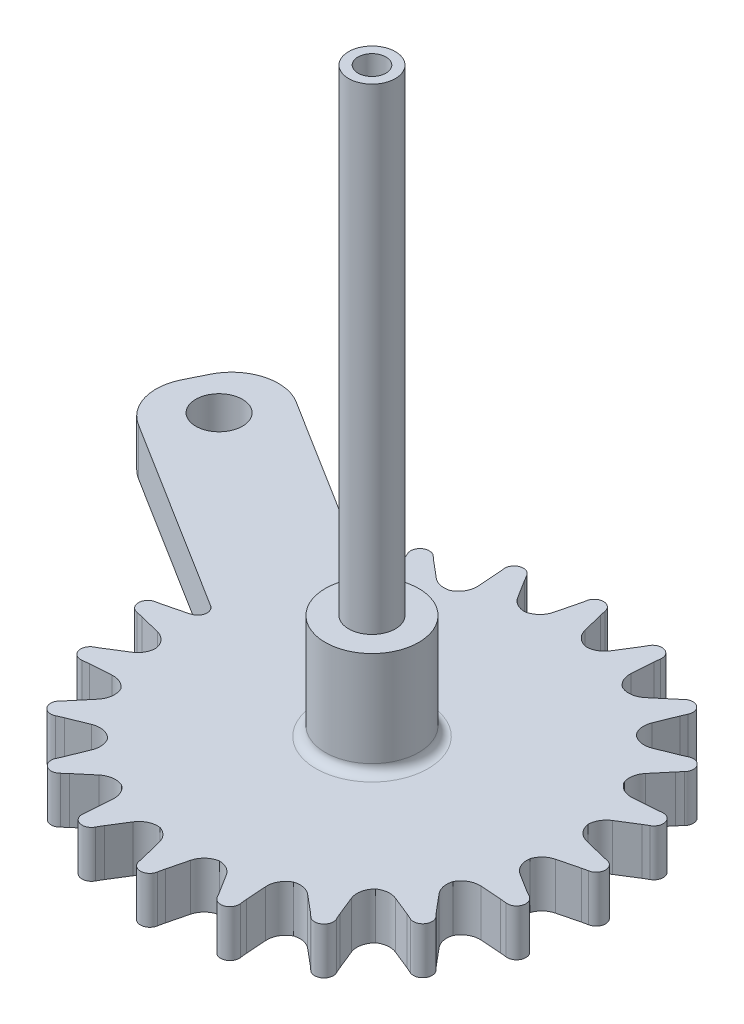
from build123d import *

# Parameters (mm, degrees)
SKETCH1_R           = 20
BOSS_EXTRUDE1_DEPTH = 5
BOSS_EXTRUDE2_START = -5
BOSS_EXTRUDE2_DEPTH = 5
FILLET1_R           = 2
CIRPATTERN1_DEPTH   = 5
SKETCH4_R           = 2.5
BOSS_EXTRUDE3_DEPTH = 5
FILLET2_R           = 5
SKETCH3_R           = 2.5
BOSS_EXTRUDE4_DEPTH = 62.2
SKETCH5_R           = 1.5
CUT_EXTRUDE1_DEPTH  = 5
FILLET4_R           = 1
SKETCH6_R           = 5
BOSS_EXTRUDE5_DEPTH = 11.2
FILLET5_R           = 1
SKETCH7_R           = 2.5
CUT_EXTRUDE2_DEPTH  = 1


# Read off the part's stored shape, not the designer's step: CirPattern1
with BuildPart() as part:
    # Sketch1 → Boss-Extrude1 (new body)
    with BuildSketch(Plane(origin=(0, 0, 0), x_dir=(1, 0, 0), z_dir=(0, 1, 0))):
        with Locations(Location((0, 0, 0), (0, 0, 270))):
            Circle(SKETCH1_R)
    extrude(amount=BOSS_EXTRUDE1_DEPTH)

    # Sketch2 → Boss-Extrude2 (add)
    with BuildSketch(Plane(origin=(0, 5, 0), x_dir=(1, 0, 0), z_dir=(0, 1, 0)).offset(BOSS_EXTRUDE2_START)):
        with BuildLine():
            Line((-2.105791814, 19.888832063), (-1.238592318, 23.357630049))
            ThreePointArc((-1.238592318, 23.357630049), (-1.158488111, 23.704119695), (-1.090754777, 24.053238521))
            ThreePointArc((-1.090754777, 24.053238521), (-0.109023339, 24.880258639), (0.877972386, 24.059528275))
            ThreePointArc((0.877972386, 24.059528275), (0.941143779, 23.742067411), (1.014556469, 23.426817347))
            Line((1.014556469, 23.426817347), (1.893724984, 19.910143286))
            ThreePointArc((1.893724984, 19.910143286), (-0.106567477, 19.999716082), (-2.105791814, 19.888832063))
        make_face()
    extrude(amount=BOSS_EXTRUDE2_DEPTH)

    # Fillet1
    fillet1_edges = [part.edges().sort_by_distance(p)[0] for p in [
        (1.893724984, 2.5, -19.910143286),
        (-2.105791814, 2.5, -19.888832063),
    ]]
    fillet(fillet1_edges, radius=FILLET1_R)

    # CirPattern1 outline → CirPattern1 (add)
    with BuildSketch(Plane(origin=(0, 0, 0), x_dir=(1, 0, 0), z_dir=(0, 1, 0))):
        with BuildLine():
            ThreePointArc((-18.818349161, -15.020578024), (-18.496093443, -14.870168545), (-18.16869336, -14.731312705))
            Line((-18.16869336, -14.731312705), (-16.10451314, -13.898848252))
            ThreePointArc((-16.10451314, -13.898848252), (-14.969635701, -13.791456908), (-13.960430105, -14.321535926))
            ThreePointArc((-13.960430105, -14.321535926), (-16.121714854, -11.835975249), (-17.845731798, -9.029388491))
            ThreePointArc((-17.845731798, -9.029388491), (-17.643410931, -10.160914391), (-18.097403186, -11.216933153))
            Line((-18.097403186, -11.216933153), (-19.549034688, -12.94914432))
            ThreePointArc((-19.549034688, -12.94914432), (-19.760926451, -13.193835771), (-19.980626471, -13.431541317))
            ThreePointArc((-19.980626471, -13.431541317), (-20.064469753, -14.712450836), (-18.818349161, -15.020578024))
        make_face()
        with BuildLine():
            ThreePointArc((-8.242021953, 19.611282475), (-8.490583131, 18.498764143), (-9.306579914, 17.702756009))
            ThreePointArc((-9.306579914, 17.702756009), (-6.422679306, 18.940675556), (-3.380631018, 19.712212811))
            ThreePointArc((-3.380631018, 19.712212811), (-4.340011374, 19.966775936), (-5.058856916, 20.651227642))
            Line((-5.058856916, 20.651227642), (-6.274384144, 22.593742485))
            ThreePointArc((-6.274384144, 22.593742485), (-6.441621387, 22.870877344), (-6.599801755, 23.153279533))
            ThreePointArc((-6.599801755, 23.153279533), (-7.792110102, 23.628842042), (-8.470228911, 22.53892747))
            ThreePointArc((-8.470228911, 22.53892747), (-8.42676349, 22.185964985), (-8.395875928, 21.831680188))
            Line((-8.395875928, 21.831680188), (-8.242021953, 19.611282475))
        make_face()
        with BuildLine():
            ThreePointArc((-13.898848252, 16.10451314), (-13.791456908, 14.969635701), (-14.321535926, 13.960430105))
            ThreePointArc((-14.321535926, 13.960430105), (-11.961321637, 16.028935855), (-9.306579913, 17.702756008))
            ThreePointArc((-9.306579913, 17.702756008), (-10.297669185, 17.648395093), (-11.192839131, 18.077211859))
            Line((-11.192839131, 18.077211859), (-12.94914432, 19.549034688))
            ThreePointArc((-12.94914432, 19.549034688), (-13.193835771, 19.760926451), (-13.431541317, 19.980626471))
            ThreePointArc((-13.431541317, 19.980626471), (-14.712450836, 20.064469753), (-15.020578024, 18.818349161))
            ThreePointArc((-15.020578024, 18.818349161), (-14.870168545, 18.496093443), (-14.731312705, 18.16869336))
            Line((-14.731312705, 18.16869336), (-13.898848252, 16.10451314))
        make_face()
        with BuildLine():
            ThreePointArc((-18.195158445, 11.021321851), (-17.742326793, 9.975175019), (-17.934600217, 8.851560036))
            ThreePointArc((-17.934600217, 8.851560036), (-16.329106467, 11.548172233), (-14.321535925, 13.960430104))
            ThreePointArc((-14.321535925, 13.960430104), (-15.247319388, 13.602466375), (-16.231188267, 13.733672628))
            Line((-16.231188267, 13.733672628), (-18.356352028, 14.59073117))
            ThreePointArc((-18.356352028, 14.59073117), (-18.654545583, 14.716638395), (-18.948508031, 14.852130478))
            ThreePointArc((-18.948508031, 14.852130478), (-20.192634375, 14.536047367), (-20.100608305, 13.255699721))
            ThreePointArc((-20.100608305, 13.255699721), (-19.857977897, 12.995695406), (-19.624745956, 12.727228237))
            Line((-19.624745956, 12.727228237), (-18.195158445, 11.021321851))
        make_face()
        with BuildLine():
            ThreePointArc((-20.710399757, 4.85928679), (-19.956454114, 4.004274704), (-19.792100881, 2.876237597))
            ThreePointArc((-19.792100881, 2.876237597), (-19.098484585, 5.936993052), (-17.934600215, 8.851560035))
            ThreePointArc((-17.934600215, 8.851560035), (-18.704455735, 8.225033474), (-19.680715605, 8.045785833))
            Line((-19.680715605, 8.045785833), (-21.966712103, 8.204185225))
            ThreePointArc((-21.966712103, 8.204185225), (-22.289218499, 8.231783236), (-22.610662757, 8.269804472))
            ThreePointArc((-22.610662757, 8.269804472), (-23.696222171, 7.584735387), (-23.213050996, 6.395490034))
            ThreePointArc((-23.213050996, 6.395490034), (-22.901950013, 6.223188155), (-22.597172338, 6.039933339))
            Line((-22.597172338, 6.039933339), (-20.710399757, 4.85928679))
        make_face()
        with BuildLine():
            ThreePointArc((-21.198362842, -1.778409119), (-20.217104661, -2.358591919), (-19.712212811, -3.380631018))
            ThreePointArc((-19.712212811, -3.380631018), (-19.998369964, -0.255340374), (-19.792100879, 2.876237597))
            ThreePointArc((-19.792100879, 2.876237597), (-20.330669633, 2.042476989), (-21.203757377, 1.570321461))
            Line((-21.203757377, 1.570321461), (-23.426817347, 1.014556469))
            ThreePointArc((-23.426817347, 1.014556469), (-23.74206741, 0.941143779), (-24.059528275, 0.877972386))
            ThreePointArc((-24.059528275, 0.877972386), (-24.880258639, -0.109023339), (-24.053238521, -1.090754777))
            ThreePointArc((-24.053238521, -1.090754777), (-23.704119695, -1.158488111), (-23.357630049, -1.238592318))
            Line((-23.357630049, -1.238592318), (-21.198362842, -1.778409119))
        make_face()
        with BuildLine():
            ThreePointArc((-19.579720151, -8.239834962), (-18.612665626, -8.414862877), (-17.845731799, -9.029388492))
            ThreePointArc((-17.845731799, -9.029388492), (-18.990179463, -6.274797518), (-19.71221281, -3.380631018))
            ThreePointArc((-19.71221281, -3.380631018), (-19.966775936, -4.340011374), (-20.651227642, -5.058856916))
            Line((-20.651227642, -5.058856916), (-22.593742485, -6.274384144))
            ThreePointArc((-22.593742485, -6.274384144), (-22.870877344, -6.441621387), (-23.153279533, -6.599801755))
            ThreePointArc((-23.153279533, -6.599801755), (-23.628842042, -7.792110102), (-22.53892747, -8.470228911))
            ThreePointArc((-22.53892747, -8.470228911), (-22.185964985, -8.42676349), (-21.831680188, -8.395875928))
            Line((-21.831680188, -8.395875928), (-19.579720151, -8.239834962))
        make_face()
        with BuildLine():
            ThreePointArc((3.184529229, 19.744841696), (6.085729599, 19.051611356), (8.851560036, 17.934600217))
            ThreePointArc((8.851560036, 17.934600217), (8.225033474, 18.704455735), (8.045785833, 19.680715605))
            Line((8.045785833, 19.680715605), (8.204185225, 21.966712103))
            ThreePointArc((8.204185225, 21.966712103), (8.231783236, 22.289218499), (8.269804472, 22.610662757))
            ThreePointArc((8.269804472, 22.610662757), (7.584735387, 23.696222171), (6.395490034, 23.213050996))
            ThreePointArc((6.395490034, 23.213050996), (6.223188155, 22.901950013), (6.039933339, 22.597172338))
            Line((6.039933339, 22.597172338), (4.842504233, 20.683579819))
            ThreePointArc((4.842504233, 20.683579819), (4.132483288, 20.004095101), (3.184529229, 19.744841696))
        make_face()
        with BuildLine():
            ThreePointArc((8.851560036, 17.934600217), (11.548172234, 16.329106469), (13.960430106, 14.321535927))
            ThreePointArc((13.960430106, 14.321535927), (13.602466375, 15.247319388), (13.733672628, 16.231188267))
            Line((13.733672628, 16.231188267), (14.59073117, 18.356352028))
            ThreePointArc((14.59073117, 18.356352028), (14.716638395, 18.654545583), (14.852130478, 18.948508031))
            ThreePointArc((14.852130478, 18.948508031), (14.536047367, 20.192634375), (13.255699721, 20.100608305))
            ThreePointArc((13.255699721, 20.100608305), (12.995695406, 19.857977897), (12.727228237, 19.624745956))
            Line((12.727228237, 19.624745956), (11.021321851, 18.195158445))
            ThreePointArc((11.021321851, 18.195158445), (9.975175019, 17.742326793), (8.851560036, 17.934600217))
        make_face()
        with BuildLine():
            ThreePointArc((13.960430106, 14.321535927), (16.028935857, 11.961321639), (17.70275601, 9.306579915))
            ThreePointArc((17.70275601, 9.306579915), (17.648395093, 10.297669185), (18.077211859, 11.192839131))
            Line((18.077211859, 11.192839131), (19.549034688, 12.94914432))
            ThreePointArc((19.549034688, 12.94914432), (19.760926451, 13.193835771), (19.980626471, 13.431541317))
            ThreePointArc((19.980626471, 13.431541317), (20.064469753, 14.712450836), (18.818349161, 15.020578024))
            ThreePointArc((18.818349161, 15.020578024), (18.496093443, 14.870168545), (18.16869336, 14.731312705))
            Line((18.16869336, 14.731312705), (16.10451314, 13.898848252))
            ThreePointArc((16.10451314, 13.898848252), (14.969635701, 13.791456908), (13.960430106, 14.321535927))
        make_face()
        with BuildLine():
            ThreePointArc((17.70275601, 9.306579915), (18.940675558, 6.422679307), (19.712212813, 3.380631018))
            ThreePointArc((19.712212813, 3.380631018), (19.966775936, 4.340011374), (20.651227642, 5.058856916))
            Line((20.651227642, 5.058856916), (22.593742485, 6.274384144))
            ThreePointArc((22.593742485, 6.274384144), (22.870877344, 6.441621387), (23.153279533, 6.599801755))
            ThreePointArc((23.153279533, 6.599801755), (23.628842042, 7.792110102), (22.53892747, 8.470228911))
            ThreePointArc((22.53892747, 8.470228911), (22.185964985, 8.42676349), (21.831680188, 8.395875928))
            Line((21.831680188, 8.395875928), (19.611282475, 8.242021953))
            ThreePointArc((19.611282475, 8.242021953), (18.498764143, 8.490583131), (17.70275601, 9.306579915))
        make_face()
        with BuildLine():
            ThreePointArc((19.712212813, 3.380631018), (19.998369968, 0.255340374), (19.792100883, -2.876237597))
            ThreePointArc((19.792100883, -2.876237597), (20.330669633, -2.042476989), (21.203757377, -1.570321461))
            Line((21.203757377, -1.570321461), (23.426817347, -1.014556469))
            ThreePointArc((23.426817347, -1.014556469), (23.74206741, -0.941143779), (24.059528275, -0.877972386))
            ThreePointArc((24.059528275, -0.877972386), (24.880258639, 0.109023339), (24.053238521, 1.090754777))
            ThreePointArc((24.053238521, 1.090754777), (23.704119695, 1.158488111), (23.357630049, 1.238592318))
            Line((23.357630049, 1.238592318), (21.198362842, 1.778409119))
            ThreePointArc((21.198362842, 1.778409119), (20.217104661, 2.358591919), (19.712212813, 3.380631018))
        make_face()
        with BuildLine():
            ThreePointArc((19.792100883, -2.876237597), (19.051611357, -6.085729599), (17.794386708, -9.130158911))
            ThreePointArc((17.794386708, -9.130158911), (18.590889166, -8.301383653), (19.712076244, -8.047958848))
            Line((19.712076244, -8.047958848), (21.966712103, -8.204185225))
            ThreePointArc((21.966712103, -8.204185225), (22.289218499, -8.231783236), (22.610662757, -8.269804472))
            ThreePointArc((22.610662757, -8.269804472), (23.696222171, -7.584735387), (23.213050996, -6.395490034))
            ThreePointArc((23.213050996, -6.395490034), (22.901950013, -6.223188155), (22.597172338, -6.039933339))
            Line((22.597172338, -6.039933339), (20.710399757, -4.85928679))
            ThreePointArc((20.710399757, -4.85928679), (19.956454114, -4.004274704), (19.792100883, -2.876237597))
        make_face()
        with BuildLine():
            ThreePointArc((17.794386708, -9.130158911), (16.238565258, -11.675144471), (14.321535927, -13.960430106))
            ThreePointArc((14.321535927, -13.960430106), (15.247319388, -13.602466375), (16.231188267, -13.733672628))
            Line((16.231188267, -13.733672628), (18.356352028, -14.59073117))
            ThreePointArc((18.356352028, -14.59073117), (18.654545583, -14.716638395), (18.948508031, -14.852130478))
            ThreePointArc((18.948508031, -14.852130478), (20.192634375, -14.536047367), (20.100608305, -13.255699721))
            ThreePointArc((20.100608305, -13.255699721), (19.857977897, -12.995695406), (19.624745956, -12.727228237))
            Line((19.624745956, -12.727228237), (18.174837264, -10.997072875))
            ThreePointArc((18.174837264, -10.997072875), (17.748017433, -10.111830503), (17.794386708, -9.130158911))
        make_face()
        with BuildLine():
            ThreePointArc((14.321535927, -13.960430106), (11.961321639, -16.028935857), (9.306579914, -17.70275601))
            ThreePointArc((9.306579914, -17.70275601), (10.297669185, -17.648395093), (11.192839131, -18.077211859))
            Line((11.192839131, -18.077211859), (12.94914432, -19.549034688))
            ThreePointArc((12.94914432, -19.549034688), (13.193835771, -19.760926451), (13.431541317, -19.980626471))
            ThreePointArc((13.431541317, -19.980626471), (14.712450836, -20.064469753), (15.020578024, -18.818349161))
            ThreePointArc((15.020578024, -18.818349161), (14.870168545, -18.496093443), (14.731312705, -18.16869336))
            Line((14.731312705, -18.16869336), (13.898848252, -16.10451314))
            ThreePointArc((13.898848252, -16.10451314), (13.791456908, -14.969635701), (14.321535927, -13.960430106))
        make_face()
        with BuildLine():
            ThreePointArc((9.306579914, -17.70275601), (6.422679306, -18.940675557), (3.380631018, -19.712212812))
            ThreePointArc((3.380631018, -19.712212812), (4.340011374, -19.966775936), (5.058856916, -20.651227642))
            Line((5.058856916, -20.651227642), (6.274384144, -22.593742485))
            ThreePointArc((6.274384144, -22.593742485), (6.441621387, -22.870877344), (6.599801755, -23.153279533))
            ThreePointArc((6.599801755, -23.153279533), (7.792110102, -23.628842042), (8.470228911, -22.53892747))
            ThreePointArc((8.470228911, -22.53892747), (8.42676349, -22.185964985), (8.395875928, -21.831680188))
            Line((8.395875928, -21.831680188), (8.242021953, -19.611282475))
            ThreePointArc((8.242021953, -19.611282475), (8.490583131, -18.498764143), (9.306579914, -17.70275601))
        make_face()
        with BuildLine():
            ThreePointArc((3.380631018, -19.712212812), (0.255340374, -19.998369966), (-2.876237597, -19.792100881))
            ThreePointArc((-2.876237597, -19.792100881), (-2.042476989, -20.330669633), (-1.570321461, -21.203757377))
            Line((-1.570321461, -21.203757377), (-1.014556469, -23.426817347))
            ThreePointArc((-1.014556469, -23.426817347), (-0.941143779, -23.74206741), (-0.877972386, -24.059528275))
            ThreePointArc((-0.877972386, -24.059528275), (0.109023339, -24.880258639), (1.090754777, -24.053238521))
            ThreePointArc((1.090754777, -24.053238521), (1.158488111, -23.704119695), (1.238592318, -23.357630049))
            Line((1.238592318, -23.357630049), (1.778409119, -21.198362842))
            ThreePointArc((1.778409119, -21.198362842), (2.358591919, -20.217104661), (3.380631018, -19.712212812))
        make_face()
        with BuildLine():
            ThreePointArc((-2.876237597, -19.792100881), (-5.936993053, -19.098484586), (-8.851560035, -17.934600216))
            ThreePointArc((-8.851560035, -17.934600216), (-8.225033474, -18.704455735), (-8.045785833, -19.680715605))
            Line((-8.045785833, -19.680715605), (-8.204185225, -21.966712103))
            ThreePointArc((-8.204185225, -21.966712103), (-8.231783236, -22.289218499), (-8.269804472, -22.610662757))
            ThreePointArc((-8.269804472, -22.610662757), (-7.584735387, -23.696222171), (-6.395490034, -23.213050996))
            ThreePointArc((-6.395490034, -23.213050996), (-6.223188155, -22.901950013), (-6.039933339, -22.597172338))
            Line((-6.039933339, -22.597172338), (-4.85928679, -20.710399757))
            ThreePointArc((-4.85928679, -20.710399757), (-4.004274704, -19.956454114), (-2.876237597, -19.792100881))
        make_face()
        with BuildLine():
            ThreePointArc((-8.851560035, -17.934600216), (-11.548172233, -16.329106468), (-13.960430104, -14.321535925))
            ThreePointArc((-13.960430104, -14.321535925), (-13.602466375, -15.247319388), (-13.733672628, -16.231188267))
            Line((-13.733672628, -16.231188267), (-14.59073117, -18.356352028))
            ThreePointArc((-14.59073117, -18.356352028), (-14.716638395, -18.654545583), (-14.852130478, -18.948508031))
            ThreePointArc((-14.852130478, -18.948508031), (-14.536047367, -20.192634375), (-13.255699721, -20.100608305))
            ThreePointArc((-13.255699721, -20.100608305), (-12.995695406, -19.857977897), (-12.727228237, -19.624745956))
            Line((-12.727228237, -19.624745956), (-11.021321851, -18.195158445))
            ThreePointArc((-11.021321851, -18.195158445), (-9.975175019, -17.742326793), (-8.851560035, -17.934600216))
        make_face()
    extrude(amount=CIRPATTERN1_DEPTH)

    # Sketch4 → Boss-Extrude3 (add)
    with BuildSketch(Plane.XZ):
        Polygon((-19.792100881, -2.876237597), (-45.22348238, -18.789905781), (-39.752917424, -29.87409829), (-14.321535926, -13.960430105), align=None)
        with Locations(Location((-38.161766516, -21.800567263, 0), (0, 0, 270))):
            Circle(SKETCH4_R, mode=Mode.SUBTRACT)
    extrude(amount=-BOSS_EXTRUDE3_DEPTH)

    # Fillet2
    fillet2_edges = [part.edges().sort_by_distance(p)[0] for p in [
        (-39.752917424, 2.5, -29.87409829),
        (-45.22348238, 2.5, -18.789905781),
    ]]
    fillet(fillet2_edges, radius=FILLET2_R)

    # Sketch3 → Boss-Extrude4 (add)
    with BuildSketch(Plane(origin=(0, 5, 0), x_dir=(1, 0, 0), z_dir=(0, 1, 0))):
        with Locations(Location((0, 0, 0), (0, 0, 90))):
            Circle(SKETCH3_R)
    extrude(amount=BOSS_EXTRUDE4_DEPTH)

    # Sketch5 → Cut-Extrude1 (cut)
    with BuildSketch(Plane(origin=(0, 67.2, 0), x_dir=(1, 0, 0), z_dir=(0, 1, 0))):
        with Locations(Location((0, 0, 0), (0, 0, 270))):
            Circle(SKETCH5_R)
    extrude(amount=-CUT_EXTRUDE1_DEPTH, mode=Mode.SUBTRACT)

    # Fillet4
    fillet4_edges = [part.edges().sort_by_distance(p)[0] for p in [
        (-14.321535926, 2.5, -13.960430105),
        (-19.792100881, 2.5, -2.876237597),
    ]]
    fillet(fillet4_edges, radius=FILLET4_R)

    # Sketch6 → Boss-Extrude5 (add)
    with BuildSketch(Plane(origin=(0, 5, 0), x_dir=(1, 0, 0), z_dir=(0, 1, 0))):
        with Locations(Location((0, 0, 0), (0, 0, 270))):
            Circle(SKETCH6_R)
    extrude(amount=BOSS_EXTRUDE5_DEPTH)

    # Fillet5
    fillet5_edges = [part.edges().sort_by_distance(p)[0] for p in [
        (0, 5, -5),
    ]]
    fillet(fillet5_edges, radius=FILLET5_R)

    # Sketch7 → Cut-Extrude2 (cut)
    with BuildSketch(Plane.XZ):
        with Locations(Location((0, 0, 0), (0, 0, 270))):
            Circle(SKETCH7_R)
    extrude(amount=-CUT_EXTRUDE2_DEPTH, mode=Mode.SUBTRACT)


solid = part.part
